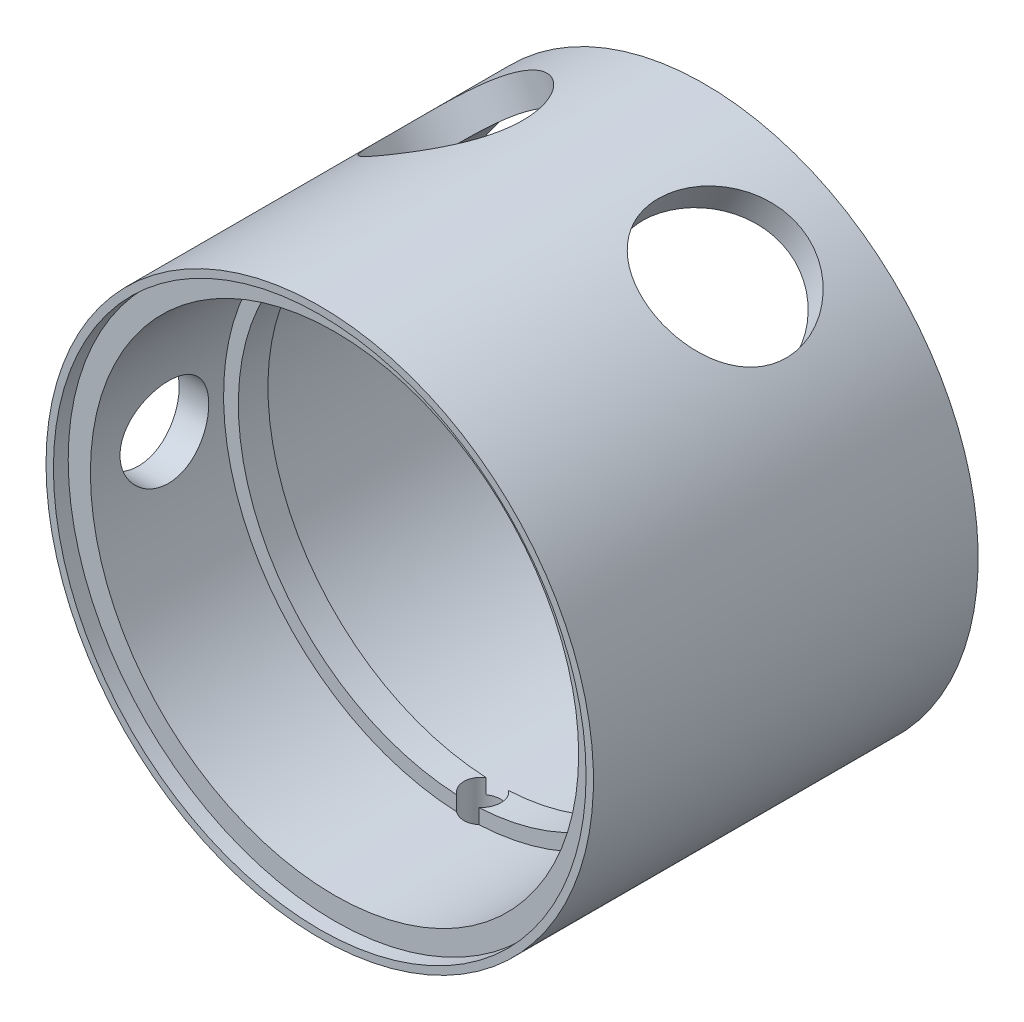
from build123d import *

# Parameters (mm, degrees)
SKETCH1_R           = 19
SKETCH1_R_2         = 13.5
BOSS_EXTRUDE1_DEPTH = 26
SKETCH2_W           = 26
SKETCH2_H           = 0.5
SKETCH4_R           = 5
CUT_EXTRUDE1_DEPTH  = 10
SKETCH5_R           = 1.25
CUT_EXTRUDE4_DEPTH  = 20
SKETCH6_R           = 3
CUT_EXTRUDE5_DEPTH  = 20


with BuildPart() as part:
    # Sketch1 → Boss-Extrude1 (new body)
    with BuildSketch(Plane.XY):
        Circle(SKETCH1_R)
        Circle(SKETCH1_R_2, mode=Mode.SUBTRACT)
    extrude(amount=BOSS_EXTRUDE1_DEPTH)

    # Sketch2 → Cut-Revolve1 (revolve, cut)
    with BuildSketch(Plane(origin=(0, 0, 0), x_dir=(0, 0, -1), z_dir=(1, 0, 0))):
        with Locations((-13, 18.75)):
            Rectangle(SKETCH2_W, SKETCH2_H)
    revolve(axis=Axis((0, 0, 0), (0, 0, 1)), mode=Mode.SUBTRACT)

    # Sketch3 → Cut-Revolve2 (revolve, cut)
    with BuildSketch(Plane(origin=(0, 0, 0), x_dir=(0, 0, -1), z_dir=(1, 0, 0))):
        Polygon((0, 18), (0, 0), (-26, 0), (-26, 18), (-25, 18), (-25, 16.5), (-16, 16.5), (-16, 15.5), (-14, 15.5), (-14, 16.5), (-1, 16.5), (-1, 18), align=None)
    revolve(axis=Axis((0, 0, 26), (0, 0, -1)), mode=Mode.SUBTRACT)

    # Sketch4 → Cut-Extrude1 (cut)
    with BuildSketch(Plane(origin=(9.25, 16.02146997, 0), x_dir=(-0.866025403784438, 0.500000000000001, 0), z_dir=(0.500000000000001, 0.866025403784438, 0))):
        with Locations((0, 7.7)):
            Circle(SKETCH4_R)
    cut_extrude1 = extrude(amount=-CUT_EXTRUDE1_DEPTH, mode=Mode.SUBTRACT)

    # Mirror1: Cut-Extrude1 across plane
    add(cut_extrude1.mirror(Plane(origin=(0, 0, 0), x_dir=(0, 0, 1), z_dir=(1, 0, 0))), mode=Mode.SUBTRACT)

    # Sketch5 → Cut-Extrude4 (cut)
    with BuildSketch(Plane(origin=(0, 0, 0), x_dir=(1, 0, 0), z_dir=(0, 1, 0))):
        with Locations((0, -15)):
            Circle(SKETCH5_R)
    extrude(amount=-CUT_EXTRUDE4_DEPTH, mode=Mode.SUBTRACT)

    # Sketch6 → Cut-Extrude5 (cut)
    with BuildSketch(Plane(origin=(0, 0, 0), x_dir=(0, 0, -1), z_dir=(1, 0, 0))):
        with Locations((-20, 0)):
            Circle(SKETCH6_R)
    extrude(amount=-CUT_EXTRUDE5_DEPTH, mode=Mode.SUBTRACT)


solid = part.part
